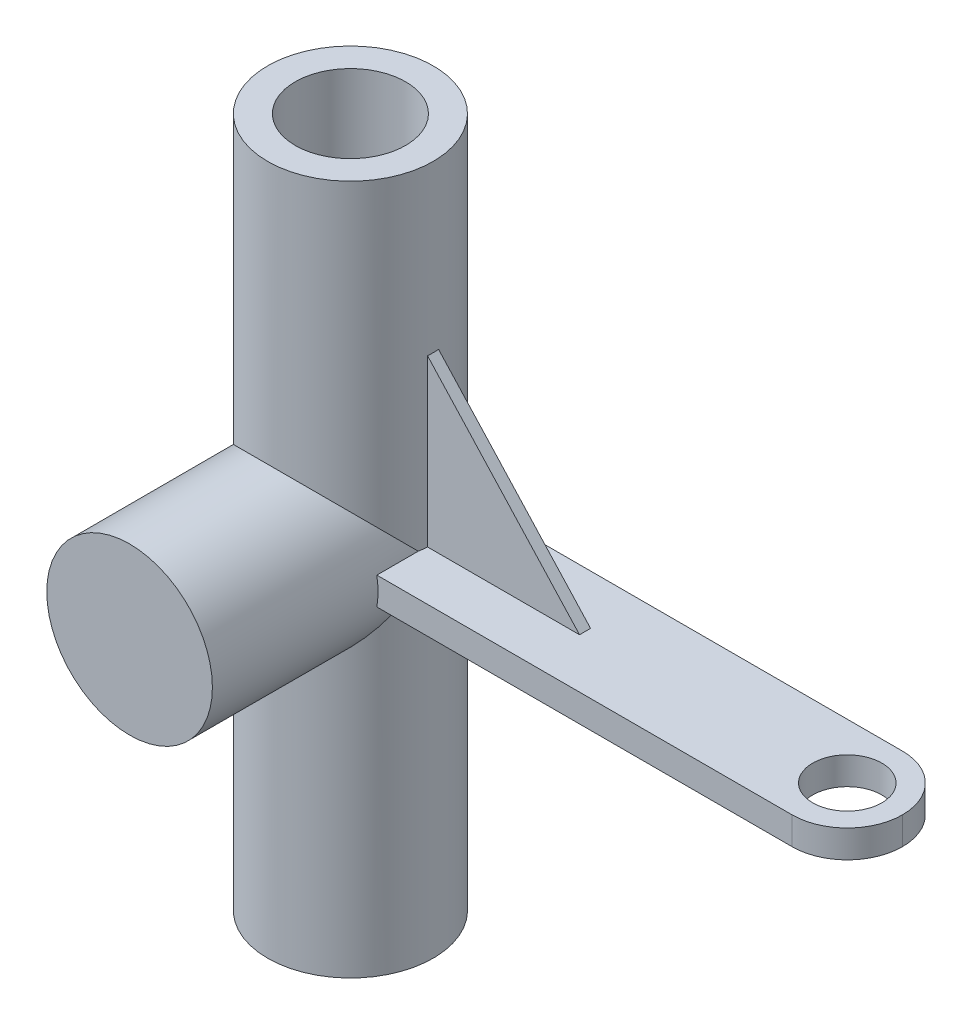
from build123d import *

# Parameters (mm, degrees)
SKETCH1_R           = 15
SKETCH1_R_2         = 10
BOSS_EXTRUDE1_DEPTH = 125
SKETCH2_R           = 15
BOSS_EXTRUDE2_DEPTH = 40
SKETCH6_W           = 20
SKETCH6_H           = 5
BOSS_EXTRUDE6_DEPTH = 100
FILLET1_R           = 10
SKETCH8_W           = 28
SKETCH8_H           = 2
BOSS_EXTRUDE7_DEPTH = 30
CUT_EXTRUDE1_DEPTH  = 30
SKETCH10_R          = 6.25
CUT_EXTRUDE2_DEPTH  = 30


with BuildPart() as part:
    # Sketch1 → Boss-Extrude1 (new body)
    with BuildSketch(Plane(origin=(0, 0, 0), x_dir=(1, 0, 0), z_dir=(0, 1, 0))):
        with Locations(Location((0, 0, 0), (0, 0, 270))):
            Circle(SKETCH1_R)
        with Locations(Location((0, 0, 0), (0, 0, 270))):
            Circle(SKETCH1_R_2, mode=Mode.SUBTRACT)
    extrude(amount=BOSS_EXTRUDE1_DEPTH)

    # Sketch2 → Boss-Extrude2 (add)
    with BuildSketch(Plane.XY):
        with Locations((0, 62.5)):
            Circle(SKETCH2_R)
    extrude(amount=BOSS_EXTRUDE2_DEPTH)

    # Sketch6 → Boss-Extrude6 (add)
    with BuildSketch(Plane(origin=(0, 0, 0), x_dir=(0, 0, -1), z_dir=(1, 0, 0))):
        with Locations((0, 62.5)):
            Rectangle(SKETCH6_W, SKETCH6_H)
    extrude(amount=BOSS_EXTRUDE6_DEPTH)

    # Fillet1
    fillet1_edges = [part.edges().sort_by_distance(p)[0] for p in [
        (100, 62.5, -10),
        (100, 62.5, 10),
    ]]
    fillet(fillet1_edges, radius=FILLET1_R - 0.0001)  # a hair under: the kernel refuses the full size

    # Sketch8 → Boss-Extrude7 (add)
    with BuildSketch(Plane(origin=(0, 65, 0), x_dir=(1, 0, 0), z_dir=(0, 1, 0))):
        with Locations((28.5, 0)):
            Rectangle(SKETCH8_W, SKETCH8_H)
    extrude(amount=BOSS_EXTRUDE7_DEPTH)

    # Sketch9 → Cut-Extrude1 (cut)
    with BuildSketch(Plane(origin=(0, 0, -1), x_dir=(-1, 0, 0), z_dir=(0, 0, -1))):
        Polygon((-14.966629547, 95), (-42.5, 65), (-42.5, 95), align=None)
    extrude(amount=-CUT_EXTRUDE1_DEPTH, mode=Mode.SUBTRACT)

    # Sketch10 → Cut-Extrude2 (cut)
    with BuildSketch(Plane(origin=(0, 65, 0), x_dir=(1, 0, 0), z_dir=(0, 1, 0))):
        with Locations(Location((90, 0, 0), (0, 0, 270))):
            Circle(SKETCH10_R)
    extrude(amount=-CUT_EXTRUDE2_DEPTH, mode=Mode.SUBTRACT)


solid = part.part
